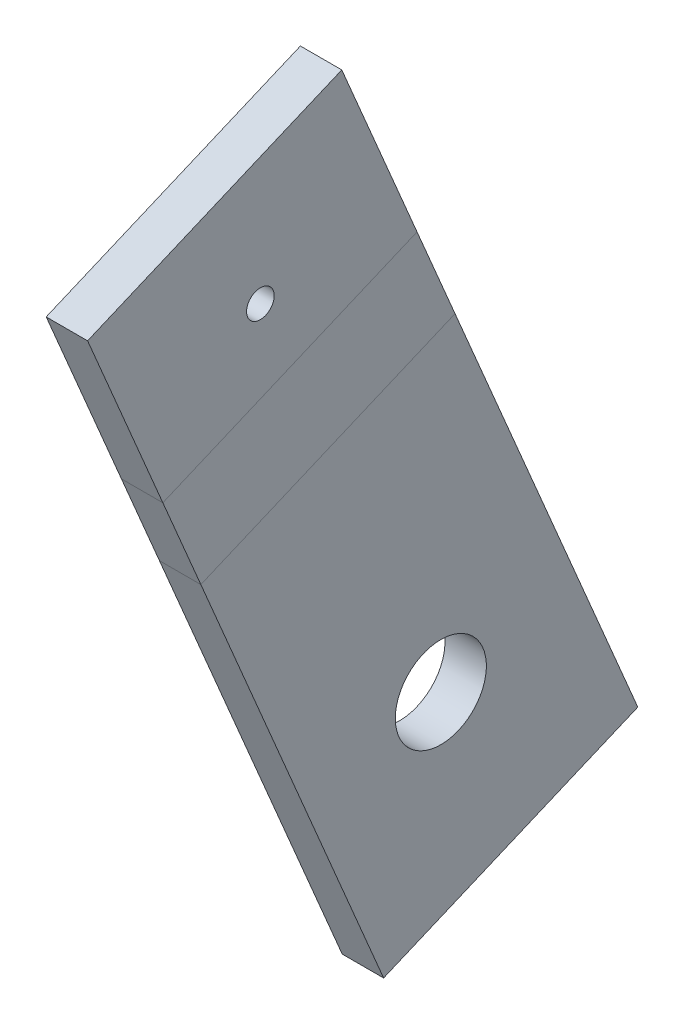
from build123d import *

# Parameters (mm, degrees)
SKETCH1_W                      = 3
SKETCH1_H                      = 40
BOSS_EXTRUDE1_DEPTH            = 20
SKETCH7_R                      = 3.3
M6_CLEARANCE_6_6_MM_THRU_DEPTH = 20
EDGE_FLANGE2_STRIP_W           = 18
EDGE_FLANGE2_STRIP_H           = 3
EDGE_FLANGE2_STRIP_CUT_DEPTH   = 20
EDGE_FLANGE2_DEPTH             = 20
SKETCH21_R                     = 1
CUT_EXTRUDE4_DEPTH             = 10
UNFOLD1_START                  = -35.37712158
UNFOLD1_DEPTH                  = 17
UNFOLD1_START_2                = -38.37712158
UNFOLD1_2_OUTLINE_R            = 1
UNFOLD1_2_DEPTH                = 3


with BuildPart() as part:
    # Sketch1 → Boss-Extrude1 (new body)
    with BuildSketch(Plane(origin=(0, 0.540345249, -1.277454147), x_dir=(-1, 0, 0), z_dir=(0, 0.3895689809965895, -0.9209972904657642))):
        with Locations((36.87712158, 1.824020416)):
            Rectangle(SKETCH1_W, SKETCH1_H)
    extrude(amount=-BOSS_EXTRUDE1_DEPTH)

    # Sketch7 → M6 clearance - 6.6 mm -thru (cut)
    with BuildSketch(Plane.ZY.offset(38.37712158)):
        with Locations((5.916117666, -8.122407734)):
            Circle(SKETCH7_R)
    extrude(amount=-M6_CLEARANCE_6_6_MM_THRU_DEPTH, mode=Mode.SUBTRACT)

    # Edge-Flange2: sheet metal written as solids
    # Edge-Flange2 strip (on a plane across the edge) → Edge-Flange2 strip cut (cut)
    with BuildSketch(Plane(origin=(-35.37712158, 20.640208919, 7.224507248), x_dir=(3.4914813388431334e-15, -0.9209972904657641, -0.3895689809965894), z_dir=(0, -0.3895689809965894, 0.9209972904657641))):
        with Locations((-3, -1.5)):
            Rectangle(EDGE_FLANGE2_STRIP_W, EDGE_FLANGE2_STRIP_H)
    extrude(amount=EDGE_FLANGE2_STRIP_CUT_DEPTH, mode=Mode.SUBTRACT)

    # Edge-Flange2 section (on a plane across the edge) → Edge-Flange2 (add)
    with BuildSketch(Plane(origin=(-35.37712158, 20.640208919, 7.224507248), x_dir=(3.4914813388431334e-15, -0.9209972904657641, -0.3895689809965894), z_dir=(0, -0.3895689809965894, 0.9209972904657641))):
        with BuildLine():
            Line((0, 3), (0, 17))
            Line((0, 17), (3, 17))
            Line((3, 17), (3, 3))
            ThreePointArc((3, 3), (3.878679656, 0.878679656), (6, 0))
            Line((6, 0), (6, -3))
            ThreePointArc((6, -3), (1.757359313, -1.242640687), (0, 3))
        make_face()
    extrude(amount=EDGE_FLANGE2_DEPTH)

    # Sketch21 → Cut-Extrude4 (cut)
    with BuildSketch(Plane(origin=(0, 17.336871798, 7.333254452), x_dir=(-0.3895689809965894, 0.3587919759473664, -0.8482360090452796), z_dir=(3.608224830031759e-15, -0.9209972904657642, -0.3895689809965895))):
        with Locations(Location((2.537974108, -28.109100712, 0), (0, 0, 22.927682802))):
            Circle(SKETCH21_R)
    extrude(amount=-CUT_EXTRUDE4_DEPTH, mode=Mode.SUBTRACT)

    # Unfold1: read off the stored shape, not the designer's step
    # Unfold1 outline → Unfold1 (cut)
    with BuildSketch(Plane.YZ.offset(UNFOLD1_START)):
        Polygon((20.640208919, 7.224507248), (12.848829299, 25.644453057), (7.322845556, 23.307039171), (15.114225176, 4.887093362), align=None)
    extrude(amount=UNFOLD1_DEPTH, mode=Mode.SUBTRACT)

    # Unfold1 2 outline → Unfold1 2 (add)
    with BuildSketch(Plane.YZ.offset(UNFOLD1_START_2)):
        Polygon((34.518333466, 13.094759956), (26.726953846, 31.514705765), (7.322845556, 23.307039171), (15.114225176, 4.887093362), align=None)
        with Locations((22.794166687, 18.993396522)):
            Circle(UNFOLD1_2_OUTLINE_R, mode=Mode.SUBTRACT)
    extrude(amount=UNFOLD1_2_DEPTH)


solid = part.part
